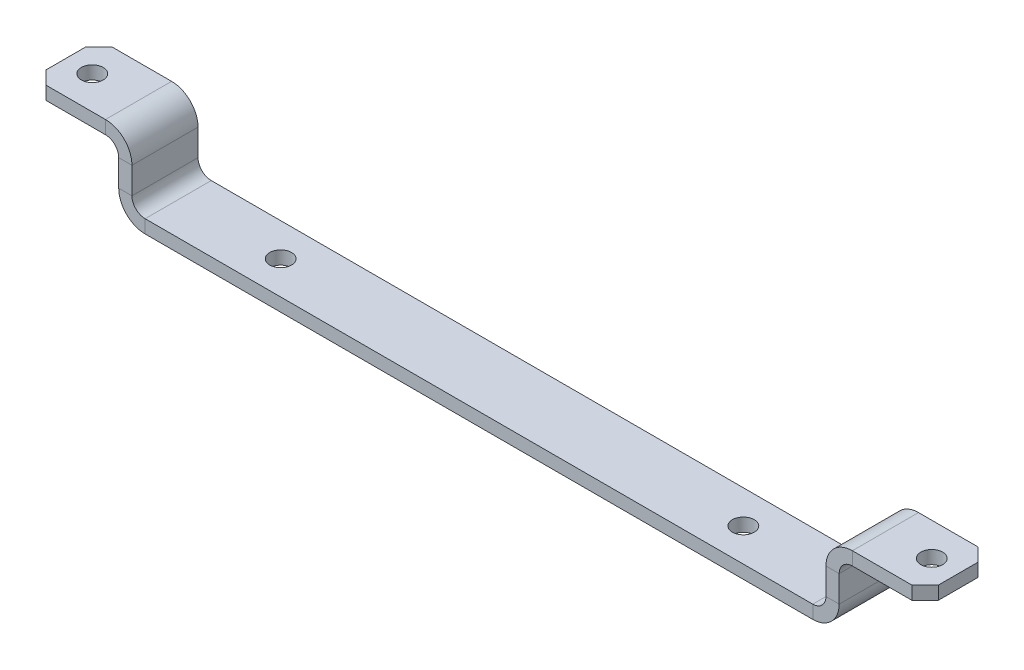
from build123d import *

# Parameters (mm, degrees)
FLANGE_BASE1_DEPTH        = 5
FURO_ROSCADO_DE_M41_D     = 3.3
FURO_ROSCADO_DE_M42_D     = 3.3
QUEBRA_CANTO1_START       = -51.265241636
QUEBRA_CANTO1_OUTLINE_W   = 99.702056148
QUEBRA_CANTO1_OUTLINE_H   = 4
QUEBRA_CANTO1_DEPTH       = 1.414213562
QUEBRA_CANTO1_START_2     = 49.851028074
QUEBRA_CANTO1_2_OUTLINE_W = 99.702056148
QUEBRA_CANTO1_2_OUTLINE_H = 4
QUEBRA_CANTO1_2_DEPTH     = 1.414213562
QUEBRA_CANTO1_START_3     = -45.608387387
QUEBRA_CANTO1_3_OUTLINE_W = 2.148971926
QUEBRA_CANTO1_3_OUTLINE_H = 4
QUEBRA_CANTO1_3_DEPTH     = 91.216774774


# Read off the part's stored shape, not the designer's step: Quebra-Canto1
# Sheet-metal steps are written as plain solids
with BuildPart() as part:
    # Esboço1 → Flange-base1 (new, symmetric)
    with BuildSketch(Plane.XY):
        with BuildLine():
            Line((-67.5, 10), (-56.5, 10))
            ThreePointArc((-56.5, 10), (-53.671572875, 8.828427125), (-52.5, 6))
            Line((-52.5, 6), (-52.5, 2))
            ThreePointArc((-52.5, 2), (-51.914213562, 0.585786438), (-50.5, 0))
            Line((-50.5, 0), (50.5, 0))
            ThreePointArc((50.5, 0), (51.914213562, 0.585786438), (52.5, 2))
            Line((52.5, 2), (52.5, 6))
            ThreePointArc((52.5, 6), (53.671572875, 8.828427125), (56.5, 10))
            Line((56.5, 10), (67.5, 10))
            Line((67.5, 10), (67.5, 8))
            Line((67.5, 8), (56.5, 8))
            ThreePointArc((56.5, 8), (55.085786438, 7.414213562), (54.5, 6))
            Line((54.5, 6), (54.5, 2))
            ThreePointArc((54.5, 2), (53.328427125, -0.828427125), (50.5, -2))
            Line((50.5, -2), (-50.5, -2))
            ThreePointArc((-50.5, -2), (-53.328427125, -0.828427125), (-54.5, 2))
            Line((-54.5, 2), (-54.5, 6))
            ThreePointArc((-54.5, 6), (-55.085786438, 7.414213562), (-56.5, 8))
            Line((-56.5, 8), (-67.5, 8))
            Line((-67.5, 8), (-67.5, 10))
        make_face()
    extrude(amount=FLANGE_BASE1_DEPTH, both=True)

    # Furo roscado de M41 (through all)
    with Locations(Plane(origin=(0, -2, 0), x_dir=(-1, 0, 0), z_dir=(0, -1, 0))):
        with Locations((35, 0), (-35, 0)):
            Hole(FURO_ROSCADO_DE_M41_D / 2)

    # Furo roscado de M42 (through all)
    with Locations(Plane(origin=(0, 10, 0), x_dir=(1, 0, 0), z_dir=(0, 1, 0))):
        with Locations((-63.5, 0), (63.5, 0)):
            Hole(FURO_ROSCADO_DE_M42_D / 2)

    # Quebra-Canto1 outline → Quebra-Canto1 (cut)
    with BuildSketch(Plane(origin=(0, 0, 0), x_dir=(0.707106781186548, 0, 0.707106781186547), z_dir=(0.707106781186547, 0, -0.707106781186548)).offset(QUEBRA_CANTO1_START)):
        with Locations((0, -9)):
            Rectangle(QUEBRA_CANTO1_OUTLINE_W, QUEBRA_CANTO1_OUTLINE_H)
    extrude(amount=QUEBRA_CANTO1_DEPTH, mode=Mode.SUBTRACT)

    # Quebra-Canto1 2 outline → Quebra-Canto1 2 (cut)
    with BuildSketch(Plane(origin=(0, 0, 0), x_dir=(0.707106781186548, 0, 0.707106781186547), z_dir=(0.707106781186547, 0, -0.707106781186548)).offset(QUEBRA_CANTO1_START_2)):
        with Locations((0, -9)):
            Rectangle(QUEBRA_CANTO1_2_OUTLINE_W, QUEBRA_CANTO1_2_OUTLINE_H)
    extrude(amount=QUEBRA_CANTO1_2_DEPTH, mode=Mode.SUBTRACT)

    # Quebra-Canto1 3 outline → Quebra-Canto1 3 (cut)
    with BuildSketch(Plane(origin=(0, 0, 0), x_dir=(0.707106781186548, 0, 0.707106781186547), z_dir=(0.707106781186547, 0, -0.707106781186548)).offset(QUEBRA_CANTO1_START_3)):
        with Locations((-50.925514037, -9)):
            Rectangle(QUEBRA_CANTO1_3_OUTLINE_W, QUEBRA_CANTO1_3_OUTLINE_H)
        with Locations((50.925514037, -9)):
            Rectangle(QUEBRA_CANTO1_3_OUTLINE_W, QUEBRA_CANTO1_3_OUTLINE_H)
    extrude(amount=QUEBRA_CANTO1_3_DEPTH, mode=Mode.SUBTRACT)


solid = part.part
